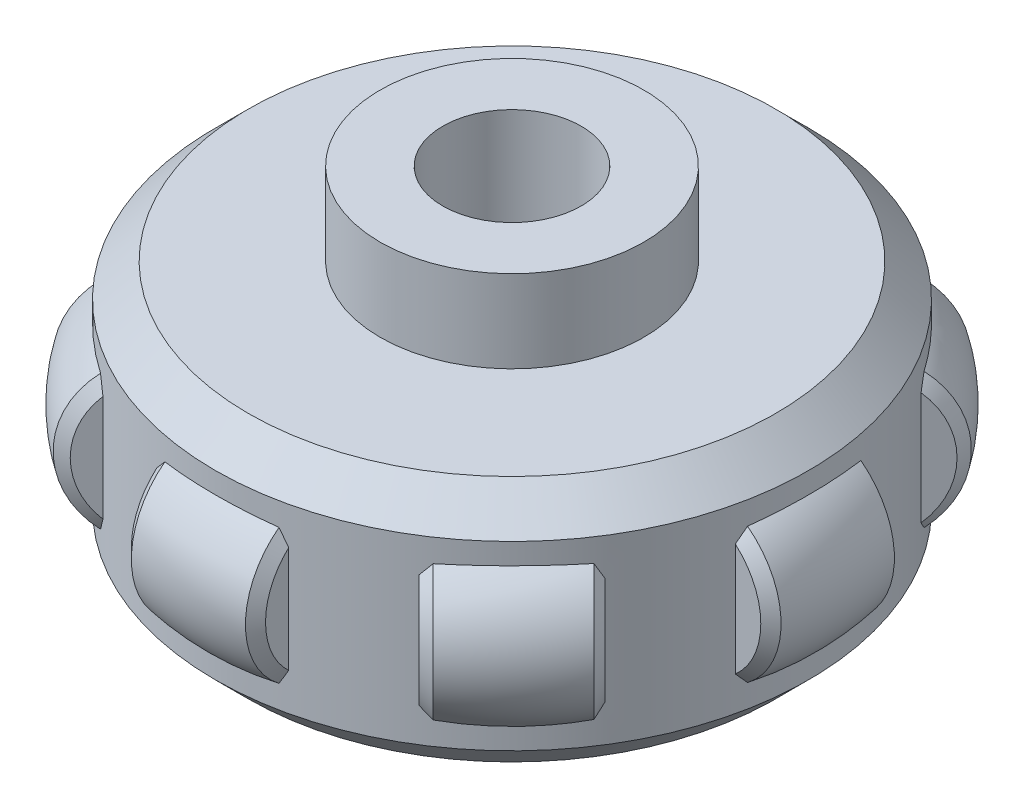
from build123d import *

# Parameters (mm, degrees)
SKETCH_1_R                             = 18
SKETCH_1_R_2                           = 4.2
EXTRUDE_1_DEPTH                        = 7.5
SKETCH_2_R                             = 8
SKETCH_2_R_2                           = 4.2
EXTRUDE_2_DEPTH                        = 12.5
CHAMFER_2_SIZE                         = 0.5
CHAMFER_2_SIZE_2                       = 0.641193422
PATTERN_CIRCULAR_1_COUNT               = 8
CHAMFER_2_OF_PATTERN_CIRCULAR_1_SIZE   = 0.5
CHAMFER_2_OF_PATTERN_CIRCULAR_1_SIZE_2 = 0.641193422
CHAMFER_1_SIZE                         = 2


with BuildPart() as part:
    # 草图1 → 凸台-拉伸1 (new, symmetric)
    with BuildSketch(Plane(origin=(0, 0, 0), x_dir=(1, 0, 0), z_dir=(0, 1, 0))):
        with Locations(Location((0, 0, 0), (0, 0, 270))):
            Circle(SKETCH_1_R)
        with Locations(Location((0, 0, 0), (0, 0, 270))):
            Circle(SKETCH_1_R_2, mode=Mode.SUBTRACT)
    extrude(amount=EXTRUDE_1_DEPTH, both=True)

    # 草图2 → 凸台-拉伸2 (add, symmetric)
    with BuildSketch(Plane(origin=(0, 0, 0), x_dir=(1, 0, 0), z_dir=(0, 1, 0))):
        with Locations(Location((0, 0, 0), (0, 0, 270))):
            Circle(SKETCH_2_R)
        with Locations(Location((0, 0, 0), (0, 0, 270))):
            Circle(SKETCH_2_R_2, mode=Mode.SUBTRACT)
    extrude(amount=EXTRUDE_2_DEPTH, both=True)

    # 草图3 → 旋转1 (revolve)
    with BuildSketch(Plane(origin=(0, 0, 0), x_dir=(1, 0, 0), z_dir=(0, 1, 0))):
        with BuildLine():
            Line((-4, 14.545765885888446), (4, 14.545765885888446))
            Line((4, 14.545765885888446), (4.000000000000001, 19.595917942265427))
            ThreePointArc((4.000000000000001, 19.595917942265427), (1.22e-15, 20.000000000000004), (-4.000000000000001, 19.595917942265427))
            Line((-4.000000000000001, 19.595917942265427), (-4, 14.545765885888446))
        make_face()
    revolve_1 = revolve(axis=Axis((-4, 0, -14.545765885888446), (1, 0, 0)))

    # 倒角2
    # the kernel refuses this chamfer: 0.641193422, 0.5 mm, written as the material it takes off along each edge
    with BuildSketch(Plane(origin=(4, 0, -14.545765885888446), x_dir=(0, -0.9503652139875794, -0.31113656172546217), z_dir=(0, -0.31113656172546217, 0.9503652139875794))) as chamfer_2_piece_1_section:
        with BuildLine():
            Line((5.050152056376979 - CHAMFER_2_SIZE, 0), (5.165810151290479, -0.6156580949150978))
            ThreePointArc((5.165810151290479, -0.6156580949150978), (5.112342974301193, -0.3177783824253986), (5.050152056376979, 0))
            Line((5.050152056376979, 0), (5.050152056376979 - CHAMFER_2_SIZE, 0))
        make_face()
    chamfer_2_piece_1 = revolve(axis=Axis((4, 0, -14.545765885888446), (1, 0, 0)), revolution_arc=71.87226167520652, mode=Mode.PRIVATE)
    chamfer_2_piece_1 = chamfer_2_piece_1 - Plane(origin=(0, 0, 0), x_dir=(-1.8e-16, 0, 1), z_dir=(0, 1, 0)) * Cylinder(18, 21, mode=Mode.PRIVATE)
    add(chamfer_2_piece_1, mode=Mode.SUBTRACT)
    with BuildSketch(Plane(origin=(-4.000000000000002, 0, -14.545765885888446), x_dir=(0, 0, -1), z_dir=(0, -1, 0))) as chamfer_2_piece_2_section:
        with BuildLine():
            Line((5.050152056376977 - CHAMFER_2_SIZE_2, 8.9e-16), (5.142956037920424, 0.48514168039051775))
            ThreePointArc((5.142956037920424, 0.48514168039051775), (5.099731731368735, 0.2510770386226149), (5.050152056376977, 0))
            Line((5.050152056376977, 0), (5.050152056376977 - CHAMFER_2_SIZE_2, 8.9e-16))
        make_face()
    chamfer_2_piece_2 = revolve(axis=Axis((-4.000000000000002, 0, -14.545765885888446), (1, 0, 0)), revolution_arc=72.29717578990173, mode=Mode.PRIVATE)
    chamfer_2_piece_2 = chamfer_2_piece_2 - Plane(origin=(0, 0, 0), x_dir=(-1.8e-16, 0, 1), z_dir=(0, 1, 0)) * Cylinder(18, 21, mode=Mode.PRIVATE)
    add(chamfer_2_piece_2, mode=Mode.SUBTRACT)
    with BuildSketch(Plane(origin=(-4.000000000000002, 0, -14.545765885888446), x_dir=(0, -0.952646493770076, -0.30408001892196146), z_dir=(0, -0.30408001892196146, 0.952646493770076))) as chamfer_2_piece_3_section:
        with BuildLine():
            Line((5.050152056376979 - CHAMFER_2_SIZE_2, 8.9e-16), (5.142956037920425, 0.4851416803905159))
            ThreePointArc((5.142956037920425, 0.4851416803905159), (5.099731731368736, 0.2510770386226148), (5.050152056376979, 0))
            Line((5.050152056376979, 0), (5.050152056376979 - CHAMFER_2_SIZE_2, 8.9e-16))
        make_face()
    chamfer_2_piece_3 = revolve(axis=Axis((-4.000000000000002, 0, -14.545765885888446), (1, 0, 0)), revolution_arc=72.29717578990176, mode=Mode.PRIVATE)
    chamfer_2_piece_3 = chamfer_2_piece_3 - Plane(origin=(0, 0, 0), x_dir=(-1.8e-16, 0, 1), z_dir=(0, 1, 0)) * Cylinder(18, 21, mode=Mode.PRIVATE)
    add(chamfer_2_piece_3, mode=Mode.SUBTRACT)
    with BuildSketch(Plane(origin=(4, 0, -14.545765885888446), x_dir=(0, 0, -1), z_dir=(0, -1, 0))) as chamfer_2_piece_4_section:
        with BuildLine():
            Line((5.165810151290483, -0.6156580949151165), (5.050152056376977 - CHAMFER_2_SIZE, 0))
            Line((5.050152056376977 - CHAMFER_2_SIZE, 0), (5.050152056376977, 0))
            ThreePointArc((5.050152056376977, 0), (5.112342974301196, -0.31777838242540835), (5.165810151290483, -0.6156580949151165))
        make_face()
    chamfer_2_piece_4 = revolve(axis=Axis((4, 0, -14.545765885888446), (1, 0, 0)), revolution_arc=71.87226167520703, mode=Mode.PRIVATE)
    chamfer_2_piece_4 = chamfer_2_piece_4 - Plane(origin=(0, 0, 0), x_dir=(-1.8e-16, 0, 1), z_dir=(0, 1, 0)) * Cylinder(18, 21, mode=Mode.PRIVATE)
    add(chamfer_2_piece_4, mode=Mode.SUBTRACT)

    # 阵列(圆周)1: 旋转1 ×8 about axis
    pattern_circular_1_axis = Axis((1.1e-16, 0, -8e-17), (0, 1, 0))
    for i in range(1, PATTERN_CIRCULAR_1_COUNT):
        add(revolve_1.rotate(pattern_circular_1_axis, i * 360 / PATTERN_CIRCULAR_1_COUNT))

    # 倒角2 of 阵列(圆周)1
    # the kernel refuses this chamfer: 0.641193422, 0.5 mm, written as the material it takes off along each edge
    with BuildSketch(Plane(origin=(-7.456982570717479, 0, -13.11383682020986), x_dir=(-0.22000677267113553, -0.950365213987582, -0.22000677267113553), z_dir=(0.6720096874144235, -0.31113656172545423, 0.6720096874144236))) as chamfer_2_of_pattern_circular_1_piece_1_section:
        with BuildLine():
            Line((5.165810151290479, -0.6156580949151136), (5.050152056376978 - CHAMFER_2_OF_PATTERN_CIRCULAR_1_SIZE, -3e-17))
            Line((5.050152056376978 - CHAMFER_2_OF_PATTERN_CIRCULAR_1_SIZE, -3e-17), (5.050152056376978, -1e-17))
            ThreePointArc((5.050152056376978, -1e-17), (5.112342974301199, -0.3177783824254055), (5.165810151290479, -0.6156580949151136))
        make_face()
    chamfer_2_of_pattern_circular_1_piece_1 = revolve(axis=Axis((-7.456982570717479, 0, -13.11383682020986), (0.7071067811865476, 0, -0.7071067811865475)), revolution_arc=71.87226167520696, mode=Mode.PRIVATE)
    chamfer_2_of_pattern_circular_1_piece_1 = chamfer_2_of_pattern_circular_1_piece_1 - Plane(origin=(0, 0, 0), x_dir=(-1.8e-16, 0, 1), z_dir=(0, 1, 0)) * Cylinder(18, 21, mode=Mode.PRIVATE)
    add(chamfer_2_of_pattern_circular_1_piece_1, mode=Mode.SUBTRACT)
    with BuildSketch(Plane(origin=(-13.11383682020986, 0, -7.456982570717479), x_dir=(-0.7071067811865474, 0, -0.7071067811865478), z_dir=(0, -1, 0))) as chamfer_2_of_pattern_circular_1_piece_2_section:
        with BuildLine():
            Line((5.0501520563769775 - CHAMFER_2_OF_PATTERN_CIRCULAR_1_SIZE_2, 0), (5.142956037920422, 0.48514168039051503))
            ThreePointArc((5.142956037920422, 0.48514168039051503), (5.099731731368735, 0.25107703862261327), (5.0501520563769775, -2.76e-15))
            Line((5.0501520563769775, -2.76e-15), (5.0501520563769775 - CHAMFER_2_OF_PATTERN_CIRCULAR_1_SIZE_2, 0))
        make_face()
    chamfer_2_of_pattern_circular_1_piece_2 = revolve(axis=Axis((-13.11383682020986, 0, -7.456982570717479), (0.7071067811865476, 0, -0.7071067811865475)), revolution_arc=72.29717578990174, mode=Mode.PRIVATE)
    chamfer_2_of_pattern_circular_1_piece_2 = chamfer_2_of_pattern_circular_1_piece_2 - Plane(origin=(0, 0, 0), x_dir=(-1.8e-16, 0, 1), z_dir=(0, 1, 0)) * Cylinder(18, 21, mode=Mode.PRIVATE)
    add(chamfer_2_of_pattern_circular_1_piece_2, mode=Mode.SUBTRACT)
    with BuildSketch(Plane(origin=(-14.545765885888446, 0, -4.000000000000002), x_dir=(-0.31113656172545795, -0.9503652139875809, 0), z_dir=(0.9503652139875809, -0.31113656172545795, 0))) as chamfer_2_of_pattern_circular_1_piece_3_section:
        with BuildLine():
            Line((5.165810151290484, -0.6156580949151059), (5.050152056376979 - CHAMFER_2_OF_PATTERN_CIRCULAR_1_SIZE, 8.9e-16))
            Line((5.050152056376979 - CHAMFER_2_OF_PATTERN_CIRCULAR_1_SIZE, 8.9e-16), (5.050152056376979, 0))
            ThreePointArc((5.050152056376979, 0), (5.112342974301189, -0.3177783824254035), (5.165810151290484, -0.6156580949151059))
        make_face()
    chamfer_2_of_pattern_circular_1_piece_3 = revolve(axis=Axis((-14.545765885888446, 0, -4.000000000000002), (1.1e-16, 0, -1)), revolution_arc=71.87226167520676, mode=Mode.PRIVATE)
    chamfer_2_of_pattern_circular_1_piece_3 = chamfer_2_of_pattern_circular_1_piece_3 - Plane(origin=(0, 0, 0), x_dir=(-1.8e-16, 0, 1), z_dir=(0, 1, 0)) * Cylinder(18, 21, mode=Mode.PRIVATE)
    add(chamfer_2_of_pattern_circular_1_piece_3, mode=Mode.SUBTRACT)
    with BuildSketch(Plane(origin=(-14.545765885888446, 0, 4), x_dir=(-1, 0, -9e-17), z_dir=(0, -1, 0))) as chamfer_2_of_pattern_circular_1_piece_4_section:
        with BuildLine():
            Line((5.050152056376977 - CHAMFER_2_OF_PATTERN_CIRCULAR_1_SIZE_2, 9.4e-16), (5.1429560379204275, 0.4851416803905195))
            ThreePointArc((5.1429560379204275, 0.4851416803905195), (5.099731731368735, 0.2510770386226162), (5.050152056376977, 0))
            Line((5.050152056376977, 0), (5.050152056376977 - CHAMFER_2_OF_PATTERN_CIRCULAR_1_SIZE_2, 9.4e-16))
        make_face()
    chamfer_2_of_pattern_circular_1_piece_4 = revolve(axis=Axis((-14.545765885888446, 0, 4), (1.1e-16, 0, -1)), revolution_arc=72.29717578990173, mode=Mode.PRIVATE)
    chamfer_2_of_pattern_circular_1_piece_4 = chamfer_2_of_pattern_circular_1_piece_4 - Plane(origin=(0, 0, 0), x_dir=(-1.8e-16, 0, 1), z_dir=(0, 1, 0)) * Cylinder(18, 21, mode=Mode.PRIVATE)
    add(chamfer_2_of_pattern_circular_1_piece_4, mode=Mode.SUBTRACT)
    with BuildSketch(Plane(origin=(-13.11383682020986, 0, 7.456982570717479), x_dir=(-0.22000677267113622, -0.9503652139875818, 0.22000677267113622), z_dir=(0.6720096874144235, -0.31113656172545523, -0.6720096874144234))) as chamfer_2_of_pattern_circular_1_piece_5_section:
        with BuildLine():
            Line((5.165810151290476, -0.6156580949151126), (5.0501520563769775 - CHAMFER_2_OF_PATTERN_CIRCULAR_1_SIZE, -4e-17))
            Line((5.0501520563769775 - CHAMFER_2_OF_PATTERN_CIRCULAR_1_SIZE, -4e-17), (5.0501520563769775, -1.24e-15))
            ThreePointArc((5.0501520563769775, -1.24e-15), (5.1123429743012, -0.3177783824254057), (5.165810151290476, -0.6156580949151126))
        make_face()
    chamfer_2_of_pattern_circular_1_piece_5 = revolve(axis=Axis((-13.11383682020986, 0, 7.456982570717479), (-0.7071067811865475, 0, -0.7071067811865476)), revolution_arc=71.87226167520687, mode=Mode.PRIVATE)
    chamfer_2_of_pattern_circular_1_piece_5 = chamfer_2_of_pattern_circular_1_piece_5 - Plane(origin=(0, 0, 0), x_dir=(-1.8e-16, 0, 1), z_dir=(0, 1, 0)) * Cylinder(18, 21, mode=Mode.PRIVATE)
    add(chamfer_2_of_pattern_circular_1_piece_5, mode=Mode.SUBTRACT)
    with BuildSketch(Plane(origin=(-7.456982570717479, 0, 13.11383682020986), x_dir=(-0.7071067811865478, 0, 0.7071067811865474), z_dir=(0, -1, 0))) as chamfer_2_of_pattern_circular_1_piece_6_section:
        with BuildLine():
            Line((5.0501520563769775 - CHAMFER_2_OF_PATTERN_CIRCULAR_1_SIZE_2, -1.3e-16), (5.142956037920424, 0.48514168039051647))
            ThreePointArc((5.142956037920424, 0.48514168039051647), (5.099731731368732, 0.25107703862261577), (5.0501520563769775, -2.75e-15))
            Line((5.0501520563769775, -2.75e-15), (5.0501520563769775 - CHAMFER_2_OF_PATTERN_CIRCULAR_1_SIZE_2, -1.3e-16))
        make_face()
    chamfer_2_of_pattern_circular_1_piece_6 = revolve(axis=Axis((-7.456982570717479, 0, 13.11383682020986), (-0.7071067811865475, 0, -0.7071067811865476)), revolution_arc=72.29717578990174, mode=Mode.PRIVATE)
    chamfer_2_of_pattern_circular_1_piece_6 = chamfer_2_of_pattern_circular_1_piece_6 - Plane(origin=(0, 0, 0), x_dir=(-1.8e-16, 0, 1), z_dir=(0, 1, 0)) * Cylinder(18, 21, mode=Mode.PRIVATE)
    add(chamfer_2_of_pattern_circular_1_piece_6, mode=Mode.SUBTRACT)
    with BuildSketch(Plane(origin=(-4.000000000000002, 0, 14.545765885888446), x_dir=(0, -0.9503652139875814, 0.3111365617254566), z_dir=(0, -0.3111365617254566, -0.9503652139875814))) as chamfer_2_of_pattern_circular_1_piece_7_section:
        with BuildLine():
            Line((5.165810151290479, -0.6156580949151074), (5.050152056376979 - CHAMFER_2_OF_PATTERN_CIRCULAR_1_SIZE, 8.9e-16))
            Line((5.050152056376979 - CHAMFER_2_OF_PATTERN_CIRCULAR_1_SIZE, 8.9e-16), (5.050152056376979, 8.9e-16))
            ThreePointArc((5.050152056376979, 8.9e-16), (5.112342974301196, -0.3177783824254036), (5.165810151290479, -0.6156580949151074))
        make_face()
    chamfer_2_of_pattern_circular_1_piece_7 = revolve(axis=Axis((-4.000000000000002, 0, 14.545765885888446), (-1, 0, -1.2e-16)), revolution_arc=71.87226167520677, mode=Mode.PRIVATE)
    chamfer_2_of_pattern_circular_1_piece_7 = chamfer_2_of_pattern_circular_1_piece_7 - Plane(origin=(0, 0, 0), x_dir=(-1.8e-16, 0, 1), z_dir=(0, 1, 0)) * Cylinder(18, 21, mode=Mode.PRIVATE)
    add(chamfer_2_of_pattern_circular_1_piece_7, mode=Mode.SUBTRACT)
    with BuildSketch(Plane(origin=(4, 0, 14.545765885888446), x_dir=(0, 0, 1), z_dir=(0, -1, 0))) as chamfer_2_of_pattern_circular_1_piece_8_section:
        with BuildLine():
            Line((5.050152056376977 - CHAMFER_2_OF_PATTERN_CIRCULAR_1_SIZE_2, 8.9e-16), (5.1429560379204275, 0.4851416803905182))
            ThreePointArc((5.1429560379204275, 0.4851416803905182), (5.099731731368735, 0.2510770386226149), (5.050152056376977, 0))
            Line((5.050152056376977, 0), (5.050152056376977 - CHAMFER_2_OF_PATTERN_CIRCULAR_1_SIZE_2, 8.9e-16))
        make_face()
    chamfer_2_of_pattern_circular_1_piece_8 = revolve(axis=Axis((4, 0, 14.545765885888446), (-1, 0, -1.2e-16)), revolution_arc=72.29717578990173, mode=Mode.PRIVATE)
    chamfer_2_of_pattern_circular_1_piece_8 = chamfer_2_of_pattern_circular_1_piece_8 - Plane(origin=(0, 0, 0), x_dir=(-1.8e-16, 0, 1), z_dir=(0, 1, 0)) * Cylinder(18, 21, mode=Mode.PRIVATE)
    add(chamfer_2_of_pattern_circular_1_piece_8, mode=Mode.SUBTRACT)
    with BuildSketch(Plane(origin=(7.456982570717478, 0, 13.113836820209862), x_dir=(0.22000677267113922, -0.9503652139875803, 0.22000677267113902), z_dir=(-0.6720096874144224, -0.31113656172545934, -0.6720096874144226))) as chamfer_2_of_pattern_circular_1_piece_9_section:
        with BuildLine():
            Line((5.16581015129048, -0.6156580949151009), (5.050152056376979 - CHAMFER_2_OF_PATTERN_CIRCULAR_1_SIZE, 1.54e-15))
            Line((5.050152056376979 - CHAMFER_2_OF_PATTERN_CIRCULAR_1_SIZE, 1.54e-15), (5.050152056376979, 1.5e-15))
            ThreePointArc((5.050152056376979, 1.5e-15), (5.112342974301193, -0.3177783824254027), (5.16581015129048, -0.6156580949151009))
        make_face()
    chamfer_2_of_pattern_circular_1_piece_9 = revolve(axis=Axis((7.456982570717478, 0, 13.113836820209862), (-0.7071067811865477, 0, 0.7071067811865475)), revolution_arc=71.87226167520664, mode=Mode.PRIVATE)
    chamfer_2_of_pattern_circular_1_piece_9 = chamfer_2_of_pattern_circular_1_piece_9 - Plane(origin=(0, 0, 0), x_dir=(-1.8e-16, 0, 1), z_dir=(0, 1, 0)) * Cylinder(18, 21, mode=Mode.PRIVATE)
    add(chamfer_2_of_pattern_circular_1_piece_9, mode=Mode.SUBTRACT)
    with BuildSketch(Plane(origin=(13.11383682020986, 0, 7.45698257071748), x_dir=(0.7071067811865474, 0, 0.7071067811865478), z_dir=(0, -1.0000000000000002, 0))) as chamfer_2_of_pattern_circular_1_piece_10_section:
        with BuildLine():
            Line((5.05015205637698 - CHAMFER_2_OF_PATTERN_CIRCULAR_1_SIZE_2, -1e-16), (5.142956037920427, 0.48514168039052397))
            ThreePointArc((5.142956037920427, 0.48514168039052397), (5.099731731368734, 0.25107703862261715), (5.05015205637698, -2.9e-16))
            Line((5.05015205637698, -2.9e-16), (5.05015205637698 - CHAMFER_2_OF_PATTERN_CIRCULAR_1_SIZE_2, -1e-16))
        make_face()
    chamfer_2_of_pattern_circular_1_piece_10 = revolve(axis=Axis((13.11383682020986, 0, 7.45698257071748), (-0.7071067811865477, 0, 0.7071067811865475)), revolution_arc=72.29717578990181, mode=Mode.PRIVATE)
    chamfer_2_of_pattern_circular_1_piece_10 = chamfer_2_of_pattern_circular_1_piece_10 - Plane(origin=(0, 0, 0), x_dir=(-1.8e-16, 0, 1), z_dir=(0, 1, 0)) * Cylinder(18, 21, mode=Mode.PRIVATE)
    add(chamfer_2_of_pattern_circular_1_piece_10, mode=Mode.SUBTRACT)
    with BuildSketch(Plane(origin=(14.545765885888446, 0, 4.0000000000000036), x_dir=(0.3111365617254551, -0.9503652139875818, 0), z_dir=(-0.9503652139875818, -0.3111365617254551, 0))) as chamfer_2_of_pattern_circular_1_piece_11_section:
        with BuildLine():
            Line((5.165810151290479, -0.6156580949151111), (5.050152056376979 - CHAMFER_2_OF_PATTERN_CIRCULAR_1_SIZE, 0))
            Line((5.050152056376979 - CHAMFER_2_OF_PATTERN_CIRCULAR_1_SIZE, 0), (5.050152056376979, 0))
            ThreePointArc((5.050152056376979, 0), (5.112342974301195, -0.3177783824254057), (5.165810151290479, -0.6156580949151111))
        make_face()
    chamfer_2_of_pattern_circular_1_piece_11 = revolve(axis=Axis((14.545765885888446, 0, 4.0000000000000036), (-2.2e-16, 0, 1)), revolution_arc=71.87226167520687, mode=Mode.PRIVATE)
    chamfer_2_of_pattern_circular_1_piece_11 = chamfer_2_of_pattern_circular_1_piece_11 - Plane(origin=(0, 0, 0), x_dir=(-1.8e-16, 0, 1), z_dir=(0, 1, 0)) * Cylinder(18, 21, mode=Mode.PRIVATE)
    add(chamfer_2_of_pattern_circular_1_piece_11, mode=Mode.SUBTRACT)
    with BuildSketch(Plane(origin=(14.545765885888448, 0, -3.9999999999999987), x_dir=(1, 0, 2.6e-16), z_dir=(0, -1, 0))) as chamfer_2_of_pattern_circular_1_piece_12_section:
        with BuildLine():
            Line((5.050152056376978 - CHAMFER_2_OF_PATTERN_CIRCULAR_1_SIZE_2, 6.1e-16), (5.142956037920426, 0.4851416803905182))
            ThreePointArc((5.142956037920426, 0.4851416803905182), (5.099731731368733, 0.2510770386226171), (5.050152056376978, 0))
            Line((5.050152056376978, 0), (5.050152056376978 - CHAMFER_2_OF_PATTERN_CIRCULAR_1_SIZE_2, 6.1e-16))
        make_face()
    chamfer_2_of_pattern_circular_1_piece_12 = revolve(axis=Axis((14.545765885888448, 0, -3.9999999999999987), (-2.2e-16, 0, 1)), revolution_arc=72.29717578990179, mode=Mode.PRIVATE)
    chamfer_2_of_pattern_circular_1_piece_12 = chamfer_2_of_pattern_circular_1_piece_12 - Plane(origin=(0, 0, 0), x_dir=(-1.8e-16, 0, 1), z_dir=(0, 1, 0)) * Cylinder(18, 21, mode=Mode.PRIVATE)
    add(chamfer_2_of_pattern_circular_1_piece_12, mode=Mode.SUBTRACT)
    with BuildSketch(Plane(origin=(13.113836820209862, 0, -7.456982570717476), x_dir=(0.22000677267113555, -0.9503652139875821, -0.2200067726711354), z_dir=(-0.6720096874144238, -0.31113656172545423, 0.6720096874144235))) as chamfer_2_of_pattern_circular_1_piece_13_section:
        with BuildLine():
            Line((5.05015205637698 - CHAMFER_2_OF_PATTERN_CIRCULAR_1_SIZE, 1.48e-15), (5.165810151290479, -0.6156580949151137))
            ThreePointArc((5.165810151290479, -0.6156580949151137), (5.112342974301197, -0.31777838242540796), (5.05015205637698, 1.9e-16))
            Line((5.05015205637698, 1.9e-16), (5.05015205637698 - CHAMFER_2_OF_PATTERN_CIRCULAR_1_SIZE, 1.48e-15))
        make_face()
    chamfer_2_of_pattern_circular_1_piece_13 = revolve(axis=Axis((13.113836820209862, 0, -7.456982570717476), (0.7071067811865474, 0, 0.7071067811865477)), revolution_arc=71.87226167520691, mode=Mode.PRIVATE)
    chamfer_2_of_pattern_circular_1_piece_13 = chamfer_2_of_pattern_circular_1_piece_13 - Plane(origin=(0, 0, 0), x_dir=(-1.8e-16, 0, 1), z_dir=(0, 1, 0)) * Cylinder(18, 21, mode=Mode.PRIVATE)
    add(chamfer_2_of_pattern_circular_1_piece_13, mode=Mode.SUBTRACT)
    with BuildSketch(Plane(origin=(7.456982570717481, 0, -13.113836820209858), x_dir=(0.7071067811865477, 0, -0.7071067811865475), z_dir=(0, -1, 0))) as chamfer_2_of_pattern_circular_1_piece_14_section:
        with BuildLine():
            Line((5.050152056376982 - CHAMFER_2_OF_PATTERN_CIRCULAR_1_SIZE_2, -1.5e-16), (5.142956037920426, 0.48514168039051647))
            ThreePointArc((5.142956037920426, 0.48514168039051647), (5.099731731368735, 0.2510770386226162), (5.050152056376982, -6e-17))
            Line((5.050152056376982, -6e-17), (5.050152056376982 - CHAMFER_2_OF_PATTERN_CIRCULAR_1_SIZE_2, -1.5e-16))
        make_face()
    chamfer_2_of_pattern_circular_1_piece_14 = revolve(axis=Axis((7.456982570717481, 0, -13.113836820209858), (0.7071067811865474, 0, 0.7071067811865477)), revolution_arc=72.29717578990177, mode=Mode.PRIVATE)
    chamfer_2_of_pattern_circular_1_piece_14 = chamfer_2_of_pattern_circular_1_piece_14 - Plane(origin=(0, 0, 0), x_dir=(-1.8e-16, 0, 1), z_dir=(0, 1, 0)) * Cylinder(18, 21, mode=Mode.PRIVATE)
    add(chamfer_2_of_pattern_circular_1_piece_14, mode=Mode.SUBTRACT)
    with BuildSketch(Plane(origin=(7.456982570717481, 0, -13.113836820209858), x_dir=(0.21501704340305255, -0.952646493770076, -0.21501704340305272), z_dir=(-0.673622795818409, -0.30408001892196146, 0.6736227958184087))) as chamfer_2_of_pattern_circular_1_piece_15_section:
        with BuildLine():
            Line((5.05015205637698 - CHAMFER_2_OF_PATTERN_CIRCULAR_1_SIZE_2, 1.04e-15), (5.142956037920427, 0.48514168039051797))
            ThreePointArc((5.142956037920427, 0.48514168039051797), (5.099731731368734, 0.2510770386226174), (5.05015205637698, 1.15e-15))
            Line((5.05015205637698, 1.15e-15), (5.05015205637698 - CHAMFER_2_OF_PATTERN_CIRCULAR_1_SIZE_2, 1.04e-15))
        make_face()
    chamfer_2_of_pattern_circular_1_piece_15 = revolve(axis=Axis((7.456982570717481, 0, -13.113836820209858), (0.7071067811865474, 0, 0.7071067811865477)), revolution_arc=72.29717578990179, mode=Mode.PRIVATE)
    chamfer_2_of_pattern_circular_1_piece_15 = chamfer_2_of_pattern_circular_1_piece_15 - Plane(origin=(0, 0, 0), x_dir=(-1.8e-16, 0, 1), z_dir=(0, 1, 0)) * Cylinder(18, 21, mode=Mode.PRIVATE)
    add(chamfer_2_of_pattern_circular_1_piece_15, mode=Mode.SUBTRACT)
    with BuildSketch(Plane(origin=(13.113836820209862, 0, -7.456982570717476), x_dir=(0.7071067811865477, 0, -0.7071067811865475), z_dir=(0, -1, 0))) as chamfer_2_of_pattern_circular_1_piece_16_section:
        with BuildLine():
            Line((5.165810151290481, -0.6156580949151026), (5.05015205637698 - CHAMFER_2_OF_PATTERN_CIRCULAR_1_SIZE, 1.3e-16))
            Line((5.05015205637698 - CHAMFER_2_OF_PATTERN_CIRCULAR_1_SIZE, 1.3e-16), (5.05015205637698, -3.2e-16))
            ThreePointArc((5.05015205637698, -3.2e-16), (5.112342974301196, -0.31777838242540457), (5.165810151290481, -0.6156580949151026))
        make_face()
    chamfer_2_of_pattern_circular_1_piece_16 = revolve(axis=Axis((13.113836820209862, 0, -7.456982570717476), (0.7071067811865474, 0, 0.7071067811865477)), revolution_arc=71.87226167520666, mode=Mode.PRIVATE)
    chamfer_2_of_pattern_circular_1_piece_16 = chamfer_2_of_pattern_circular_1_piece_16 - Plane(origin=(0, 0, 0), x_dir=(-1.8e-16, 0, 1), z_dir=(0, 1, 0)) * Cylinder(18, 21, mode=Mode.PRIVATE)
    add(chamfer_2_of_pattern_circular_1_piece_16, mode=Mode.SUBTRACT)
    with BuildSketch(Plane(origin=(14.545765885888448, 0, -3.9999999999999987), x_dir=(0.3040800189219611, -0.9526464937700762, 0), z_dir=(-0.9526464937700762, -0.3040800189219611, 0))) as chamfer_2_of_pattern_circular_1_piece_17_section:
        with BuildLine():
            Line((5.0501520563769775 - CHAMFER_2_OF_PATTERN_CIRCULAR_1_SIZE_2, 9.4e-16), (5.142956037920426, 0.48514168039051864))
            ThreePointArc((5.142956037920426, 0.48514168039051864), (5.099731731368734, 0.25107703862261666), (5.0501520563769775, 4.4e-16))
            Line((5.0501520563769775, 4.4e-16), (5.0501520563769775 - CHAMFER_2_OF_PATTERN_CIRCULAR_1_SIZE_2, 9.4e-16))
        make_face()
    chamfer_2_of_pattern_circular_1_piece_17 = revolve(axis=Axis((14.545765885888448, 0, -3.9999999999999987), (-2.2e-16, 0, 1)), revolution_arc=72.29717578990176, mode=Mode.PRIVATE)
    chamfer_2_of_pattern_circular_1_piece_17 = chamfer_2_of_pattern_circular_1_piece_17 - Plane(origin=(0, 0, 0), x_dir=(-1.8e-16, 0, 1), z_dir=(0, 1, 0)) * Cylinder(18, 21, mode=Mode.PRIVATE)
    add(chamfer_2_of_pattern_circular_1_piece_17, mode=Mode.SUBTRACT)
    with BuildSketch(Plane(origin=(14.545765885888446, 0, 4.0000000000000036), x_dir=(1, 0, 1.8e-16), z_dir=(0, -1, 0))) as chamfer_2_of_pattern_circular_1_piece_18_section:
        with BuildLine():
            Line((5.165810151290479, -0.6156580949150929), (5.05015205637698 - CHAMFER_2_OF_PATTERN_CIRCULAR_1_SIZE, 9e-17))
            Line((5.05015205637698 - CHAMFER_2_OF_PATTERN_CIRCULAR_1_SIZE, 9e-17), (5.05015205637698, 0))
            ThreePointArc((5.05015205637698, 0), (5.112342974301189, -0.3177783824253968), (5.165810151290479, -0.6156580949150929))
        make_face()
    chamfer_2_of_pattern_circular_1_piece_18 = revolve(axis=Axis((14.545765885888446, 0, 4.0000000000000036), (-2.2e-16, 0, 1)), revolution_arc=71.8722616752064, mode=Mode.PRIVATE)
    chamfer_2_of_pattern_circular_1_piece_18 = chamfer_2_of_pattern_circular_1_piece_18 - Plane(origin=(0, 0, 0), x_dir=(-1.8e-16, 0, 1), z_dir=(0, 1, 0)) * Cylinder(18, 21, mode=Mode.PRIVATE)
    add(chamfer_2_of_pattern_circular_1_piece_18, mode=Mode.SUBTRACT)
    with BuildSketch(Plane(origin=(13.11383682020986, 0, 7.45698257071748), x_dir=(0.21501704340305175, -0.9526464937700765, 0.21501704340305175), z_dir=(-0.6736227958184091, -0.30408001892196024, -0.6736227958184093))) as chamfer_2_of_pattern_circular_1_piece_19_section:
        with BuildLine():
            Line((5.05015205637698 - CHAMFER_2_OF_PATTERN_CIRCULAR_1_SIZE_2, 0), (5.1429560379204275, 0.4851416803905192))
            ThreePointArc((5.1429560379204275, 0.4851416803905192), (5.099731731368737, 0.25107703862261505), (5.05015205637698, 1.26e-15))
            Line((5.05015205637698, 1.26e-15), (5.05015205637698 - CHAMFER_2_OF_PATTERN_CIRCULAR_1_SIZE_2, 0))
        make_face()
    chamfer_2_of_pattern_circular_1_piece_19 = revolve(axis=Axis((13.11383682020986, 0, 7.45698257071748), (-0.7071067811865477, 0, 0.7071067811865475)), revolution_arc=72.29717578990181, mode=Mode.PRIVATE)
    chamfer_2_of_pattern_circular_1_piece_19 = chamfer_2_of_pattern_circular_1_piece_19 - Plane(origin=(0, 0, 0), x_dir=(-1.8e-16, 0, 1), z_dir=(0, 1, 0)) * Cylinder(18, 21, mode=Mode.PRIVATE)
    add(chamfer_2_of_pattern_circular_1_piece_19, mode=Mode.SUBTRACT)
    with BuildSketch(Plane(origin=(7.456982570717478, 0, 13.113836820209862), x_dir=(0.7071067811865472, 0, 0.7071067811865478), z_dir=(0, -1, 0))) as chamfer_2_of_pattern_circular_1_piece_20_section:
        with BuildLine():
            Line((5.165810151290478, -0.6156580949150913), (5.050152056376979 - CHAMFER_2_OF_PATTERN_CIRCULAR_1_SIZE, -5e-17))
            Line((5.050152056376979 - CHAMFER_2_OF_PATTERN_CIRCULAR_1_SIZE, -5e-17), (5.050152056376979, -2e-16))
            ThreePointArc((5.050152056376979, -2e-16), (5.1123429743011926, -0.31777838242539813), (5.165810151290478, -0.6156580949150913))
        make_face()
    chamfer_2_of_pattern_circular_1_piece_20 = revolve(axis=Axis((7.456982570717478, 0, 13.113836820209862), (-0.7071067811865477, 0, 0.7071067811865475)), revolution_arc=71.87226167520629, mode=Mode.PRIVATE)
    chamfer_2_of_pattern_circular_1_piece_20 = chamfer_2_of_pattern_circular_1_piece_20 - Plane(origin=(0, 0, 0), x_dir=(-1.8e-16, 0, 1), z_dir=(0, 1, 0)) * Cylinder(18, 21, mode=Mode.PRIVATE)
    add(chamfer_2_of_pattern_circular_1_piece_20, mode=Mode.SUBTRACT)
    with BuildSketch(Plane(origin=(4, 0, 14.545765885888446), x_dir=(0, -0.952646493770076, 0.30408001892196146), z_dir=(0, -0.30408001892196146, -0.952646493770076))) as chamfer_2_of_pattern_circular_1_piece_21_section:
        with BuildLine():
            Line((5.142956037920428, 0.4851416803905168), (5.050152056376979 - CHAMFER_2_OF_PATTERN_CIRCULAR_1_SIZE_2, 4.4e-16))
            Line((5.050152056376979 - CHAMFER_2_OF_PATTERN_CIRCULAR_1_SIZE_2, 4.4e-16), (5.050152056376979, 0))
            ThreePointArc((5.050152056376979, 0), (5.099731731368736, 0.25107703862261616), (5.142956037920428, 0.4851416803905168))
        make_face()
    chamfer_2_of_pattern_circular_1_piece_21 = revolve(axis=Axis((4, 0, 14.545765885888446), (-1, 0, -1.2e-16)), revolution_arc=72.29717578990176, mode=Mode.PRIVATE)
    chamfer_2_of_pattern_circular_1_piece_21 = chamfer_2_of_pattern_circular_1_piece_21 - Plane(origin=(0, 0, 0), x_dir=(-1.8e-16, 0, 1), z_dir=(0, 1, 0)) * Cylinder(18, 21, mode=Mode.PRIVATE)
    add(chamfer_2_of_pattern_circular_1_piece_21, mode=Mode.SUBTRACT)
    with BuildSketch(Plane(origin=(-4.000000000000002, 0, 14.545765885888446), x_dir=(-1.8e-16, 0, 1), z_dir=(0, -1, 0))) as chamfer_2_of_pattern_circular_1_piece_22_section:
        with BuildLine():
            Line((5.165810151290483, -0.6156580949151023), (5.050152056376977 - CHAMFER_2_OF_PATTERN_CIRCULAR_1_SIZE, 9e-17))
            Line((5.050152056376977 - CHAMFER_2_OF_PATTERN_CIRCULAR_1_SIZE, 9e-17), (5.050152056376977, 0))
            ThreePointArc((5.050152056376977, 0), (5.1123429743011926, -0.3177783824254017), (5.165810151290483, -0.6156580949151023))
        make_face()
    chamfer_2_of_pattern_circular_1_piece_22 = revolve(axis=Axis((-4.000000000000002, 0, 14.545765885888446), (-1, 0, -1.2e-16)), revolution_arc=71.87226167520666, mode=Mode.PRIVATE)
    chamfer_2_of_pattern_circular_1_piece_22 = chamfer_2_of_pattern_circular_1_piece_22 - Plane(origin=(0, 0, 0), x_dir=(-1.8e-16, 0, 1), z_dir=(0, 1, 0)) * Cylinder(18, 21, mode=Mode.PRIVATE)
    add(chamfer_2_of_pattern_circular_1_piece_22, mode=Mode.SUBTRACT)
    with BuildSketch(Plane(origin=(-7.456982570717479, 0, 13.11383682020986), x_dir=(-0.21501704340305272, -0.952646493770076, 0.21501704340305272), z_dir=(0.6736227958184089, -0.30408001892196157, -0.6736227958184088))) as chamfer_2_of_pattern_circular_1_piece_23_section:
        with BuildLine():
            Line((5.050152056376978 - CHAMFER_2_OF_PATTERN_CIRCULAR_1_SIZE_2, 2.41e-15), (5.142956037920425, 0.4851416803905177))
            ThreePointArc((5.142956037920425, 0.4851416803905177), (5.099731731368732, 0.2510770386226174), (5.050152056376978, -7e-17))
            Line((5.050152056376978, -7e-17), (5.050152056376978 - CHAMFER_2_OF_PATTERN_CIRCULAR_1_SIZE_2, 2.41e-15))
        make_face()
    chamfer_2_of_pattern_circular_1_piece_23 = revolve(axis=Axis((-7.456982570717479, 0, 13.11383682020986), (-0.7071067811865475, 0, -0.7071067811865476)), revolution_arc=72.29717578990177, mode=Mode.PRIVATE)
    chamfer_2_of_pattern_circular_1_piece_23 = chamfer_2_of_pattern_circular_1_piece_23 - Plane(origin=(0, 0, 0), x_dir=(-1.8e-16, 0, 1), z_dir=(0, 1, 0)) * Cylinder(18, 21, mode=Mode.PRIVATE)
    add(chamfer_2_of_pattern_circular_1_piece_23, mode=Mode.SUBTRACT)
    with BuildSketch(Plane(origin=(-13.11383682020986, 0, 7.456982570717479), x_dir=(-0.7071067811865479, 0, 0.7071067811865471), z_dir=(0, -1, 0))) as chamfer_2_of_pattern_circular_1_piece_24_section:
        with BuildLine():
            Line((5.165810151290482, -0.615658094915124), (5.0501520563769775 - CHAMFER_2_OF_PATTERN_CIRCULAR_1_SIZE, -1.36e-15))
            Line((5.0501520563769775 - CHAMFER_2_OF_PATTERN_CIRCULAR_1_SIZE, -1.36e-15), (5.0501520563769775, -1.45e-15))
            ThreePointArc((5.0501520563769775, -1.45e-15), (5.112342974301196, -0.3177783824254147), (5.165810151290482, -0.615658094915124))
        make_face()
    chamfer_2_of_pattern_circular_1_piece_24 = revolve(axis=Axis((-13.11383682020986, 0, 7.456982570717479), (-0.7071067811865475, 0, -0.7071067811865476)), revolution_arc=71.87226167520726, mode=Mode.PRIVATE)
    chamfer_2_of_pattern_circular_1_piece_24 = chamfer_2_of_pattern_circular_1_piece_24 - Plane(origin=(0, 0, 0), x_dir=(-1.8e-16, 0, 1), z_dir=(0, 1, 0)) * Cylinder(18, 21, mode=Mode.PRIVATE)
    add(chamfer_2_of_pattern_circular_1_piece_24, mode=Mode.SUBTRACT)
    with BuildSketch(Plane(origin=(-14.545765885888446, 0, 4), x_dir=(-0.30408001892196146, -0.952646493770076, 0), z_dir=(0.952646493770076, -0.30408001892196146, 0))) as chamfer_2_of_pattern_circular_1_piece_25_section:
        with BuildLine():
            Line((5.050152056376979 - CHAMFER_2_OF_PATTERN_CIRCULAR_1_SIZE_2, 8.9e-16), (5.1429560379204275, 0.4851416803905177))
            ThreePointArc((5.1429560379204275, 0.4851416803905177), (5.099731731368736, 0.2510770386226144), (5.050152056376979, 0))
            Line((5.050152056376979, 0), (5.050152056376979 - CHAMFER_2_OF_PATTERN_CIRCULAR_1_SIZE_2, 8.9e-16))
        make_face()
    chamfer_2_of_pattern_circular_1_piece_25 = revolve(axis=Axis((-14.545765885888446, 0, 4), (1.1e-16, 0, -1)), revolution_arc=72.29717578990176, mode=Mode.PRIVATE)
    chamfer_2_of_pattern_circular_1_piece_25 = chamfer_2_of_pattern_circular_1_piece_25 - Plane(origin=(0, 0, 0), x_dir=(-1.8e-16, 0, 1), z_dir=(0, 1, 0)) * Cylinder(18, 21, mode=Mode.PRIVATE)
    add(chamfer_2_of_pattern_circular_1_piece_25, mode=Mode.SUBTRACT)
    with BuildSketch(Plane(origin=(-14.545765885888446, 0, -4.000000000000002), x_dir=(-1, 0, 0), z_dir=(0, -1, 0))) as chamfer_2_of_pattern_circular_1_piece_26_section:
        with BuildLine():
            Line((5.165810151290479, -0.6156580949150978), (5.050152056376977 - CHAMFER_2_OF_PATTERN_CIRCULAR_1_SIZE, 8.9e-16))
            Line((5.050152056376977 - CHAMFER_2_OF_PATTERN_CIRCULAR_1_SIZE, 8.9e-16), (5.050152056376977, 0))
            ThreePointArc((5.050152056376977, 0), (5.1123429743011926, -0.31777838242539946), (5.165810151290479, -0.6156580949150978))
        make_face()
    chamfer_2_of_pattern_circular_1_piece_26 = revolve(axis=Axis((-14.545765885888446, 0, -4.000000000000002), (1.1e-16, 0, -1)), revolution_arc=71.87226167520652, mode=Mode.PRIVATE)
    chamfer_2_of_pattern_circular_1_piece_26 = chamfer_2_of_pattern_circular_1_piece_26 - Plane(origin=(0, 0, 0), x_dir=(-1.8e-16, 0, 1), z_dir=(0, 1, 0)) * Cylinder(18, 21, mode=Mode.PRIVATE)
    add(chamfer_2_of_pattern_circular_1_piece_26, mode=Mode.SUBTRACT)
    with BuildSketch(Plane(origin=(-13.11383682020986, 0, -7.456982570717479), x_dir=(-0.21501704340305272, -0.952646493770076, -0.21501704340305272), z_dir=(0.6736227958184088, -0.30408001892196157, 0.6736227958184089))) as chamfer_2_of_pattern_circular_1_piece_27_section:
        with BuildLine():
            Line((5.050152056376978 - CHAMFER_2_OF_PATTERN_CIRCULAR_1_SIZE_2, 2.44e-15), (5.142956037920422, 0.48514168039051525))
            ThreePointArc((5.142956037920422, 0.48514168039051525), (5.099731731368736, 0.2510770386226149), (5.050152056376978, -1.6e-16))
            Line((5.050152056376978, -1.6e-16), (5.050152056376978 - CHAMFER_2_OF_PATTERN_CIRCULAR_1_SIZE_2, 2.44e-15))
        make_face()
    chamfer_2_of_pattern_circular_1_piece_27 = revolve(axis=Axis((-13.11383682020986, 0, -7.456982570717479), (0.7071067811865476, 0, -0.7071067811865475)), revolution_arc=72.29717578990177, mode=Mode.PRIVATE)
    chamfer_2_of_pattern_circular_1_piece_27 = chamfer_2_of_pattern_circular_1_piece_27 - Plane(origin=(0, 0, 0), x_dir=(-1.8e-16, 0, 1), z_dir=(0, 1, 0)) * Cylinder(18, 21, mode=Mode.PRIVATE)
    add(chamfer_2_of_pattern_circular_1_piece_27, mode=Mode.SUBTRACT)
    with BuildSketch(Plane(origin=(-7.456982570717479, 0, -13.11383682020986), x_dir=(-0.7071067811865471, 0, -0.7071067811865479), z_dir=(0, -1, 0))) as chamfer_2_of_pattern_circular_1_piece_28_section:
        with BuildLine():
            Line((5.165810151290477, -0.6156580949151127), (5.0501520563769775 - CHAMFER_2_OF_PATTERN_CIRCULAR_1_SIZE, -1.22e-15))
            Line((5.0501520563769775 - CHAMFER_2_OF_PATTERN_CIRCULAR_1_SIZE, -1.22e-15), (5.0501520563769775, -1.41e-15))
            ThreePointArc((5.0501520563769775, -1.41e-15), (5.112342974301197, -0.31777838242540596), (5.165810151290477, -0.6156580949151127))
        make_face()
    chamfer_2_of_pattern_circular_1_piece_28 = revolve(axis=Axis((-7.456982570717479, 0, -13.11383682020986), (0.7071067811865476, 0, -0.7071067811865475)), revolution_arc=71.8722616752069, mode=Mode.PRIVATE)
    chamfer_2_of_pattern_circular_1_piece_28 = chamfer_2_of_pattern_circular_1_piece_28 - Plane(origin=(0, 0, 0), x_dir=(-1.8e-16, 0, 1), z_dir=(0, 1, 0)) * Cylinder(18, 21, mode=Mode.PRIVATE)
    add(chamfer_2_of_pattern_circular_1_piece_28, mode=Mode.SUBTRACT)

    # 倒角1
    chamfer_1_edges = [part.edges().sort_by_distance(p)[0] for p in [
        (5.51e-15, -7.5, -18),
        (5.51e-15, 7.5, -18),
    ]]
    chamfer(chamfer_1_edges, length=CHAMFER_1_SIZE)


solid = part.part
